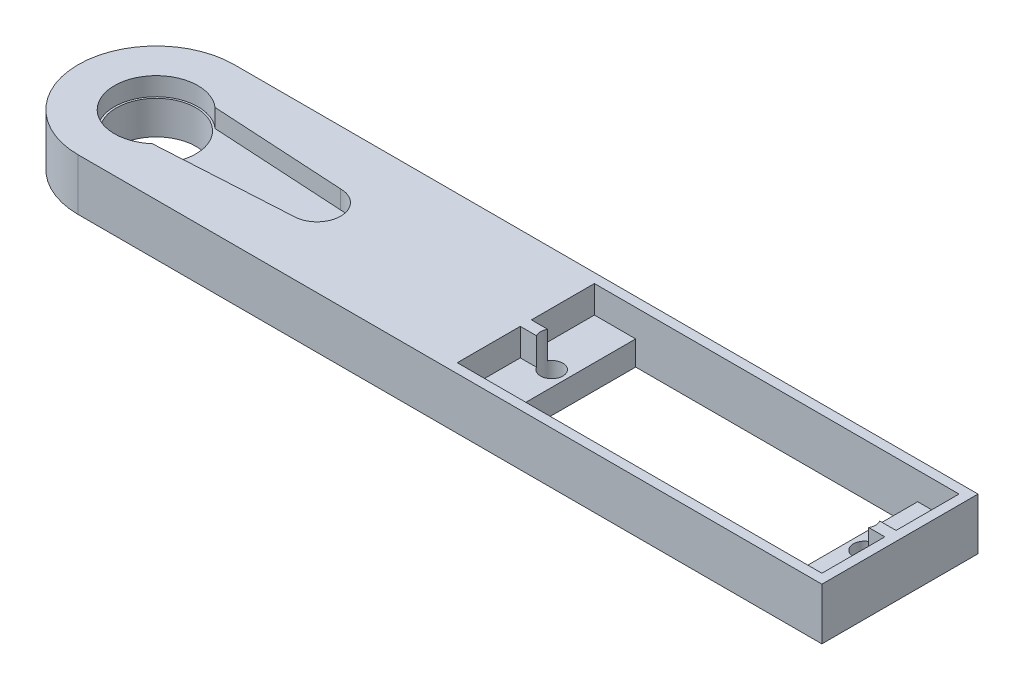
from build123d import *

# Parameters (mm, degrees)
BOSS_EXTRUDE1_DEPTH     = 3
SKETCH2_R               = 3.575
CUT_EXTRUDE1_DEPTH      = 3.95
BOSS_EXTRUDE2_DEPTH     = 1.64
SKETCH4_R               = 3.25
CUT_EXTRUDE2_DEPTH      = 63.566201739
CAVITY1_OUTLINE_R       = 3.25
CAVITY1_DEPTH           = 4.64
CAVITY1_START           = 3.19
CAVITY1_2_DEPTH         = 1.45
CUT_EXTRUDE4_DEPTH      = 63.566201739
BOSS_EXTRUDE3_START     = -4.64
BOSS_EXTRUDE3_DEPTH     = 4.64
BOSS_EXTRUDE4_DEPTH     = 4.64
BOSS_EXTRUDE5_DEPTH     = 4.64
CUT_EXTRUDE5_DEPTH      = 1.45
SKETCH7_R               = 1
CUT_EXTRUDE6_DEPTH      = 4.64
CUT_EXTRUDE7_DEPTH      = 68.226628653
CUT_EXTRUDE7_DEPTH_BACK = 68.226628653
SKETCH10_W              = 23.28963149
SKETCH10_H              = 12.3
SKETCH10_W_2            = 22.98963149
SKETCH10_H_2            = 12
CUT_EXTRUDE8_DEPTH      = 1.45
CUT_EXTRUDE9_DEPTH      = 1.45
SKETCH14_W              = 12.3
SKETCH14_H              = 3.19
CUT_EXTRUDE10_DEPTH     = 1
SKETCH15_W              = 12.3
SKETCH15_H              = 3.19
CUT_EXTRUDE11_DEPTH     = 1
CUT_EXTRUDE12_DEPTH     = 1
CUT_EXTRUDE13_DEPTH     = 1


# Read off the part's stored shape, not the designer's step: Cavity1
with BuildPart() as part:
    # Sketch1 → Boss-Extrude1 (new body)
    with BuildSketch(Plane(origin=(0, 0, 0), x_dir=(1, 0, 0), z_dir=(0, 1, 0))):
        with BuildLine():
            Line((0, 7), (55, 7))
            ThreePointArc((55, 7), (62, 0), (55, -7))
            Line((55, -7), (0, -7))
            ThreePointArc((0, -7), (-7, 0), (0, 7))
        make_face()
    extrude(amount=BOSS_EXTRUDE1_DEPTH)

    # Sketch2 → Cut-Extrude1 (cut)
    with BuildSketch(Plane.XZ):
        with Locations(Location((0, 0, 0), (0, 0, 270))):
            Circle(SKETCH2_R)
    extrude(amount=-CUT_EXTRUDE1_DEPTH, mode=Mode.SUBTRACT)

    # Sketch3 → Boss-Extrude2 (add)
    with BuildSketch(Plane(origin=(0, 3, 0), x_dir=(1, 0, 0), z_dir=(0, 1, 0))):
        with BuildLine():
            Line((0, -7), (55, -7))
            ThreePointArc((55, -7), (62, 0), (55, 7))
            Line((55, 7), (0, 7))
            ThreePointArc((0, 7), (-7, 0), (0, -7))
        make_face()
        with BuildLine():
            Line((14.43004688, 2.119993993), (2.468524523, 2.816276208))
            ThreePointArc((2.468524523, 2.816276208), (-3.745, 0), (2.468524523, -2.816276208))
            Line((2.468524523, -2.816276208), (14.43004688, -2.119993993))
            ThreePointArc((14.43004688, -2.119993993), (16.545, 0), (14.43004688, 2.119993993))
        make_face(mode=Mode.SUBTRACT)
    extrude(amount=BOSS_EXTRUDE2_DEPTH)

    # Sketch4 → Cut-Extrude2 (cut, through all)
    with BuildSketch(Plane(origin=(0, 4.64, 0), x_dir=(1, 0, 0), z_dir=(0, 1, 0))):
        with Locations(Location((55, 0, 0), (0, 0, 270))):
            Circle(SKETCH4_R)
    extrude(amount=-CUT_EXTRUDE2_DEPTH, mode=Mode.SUBTRACT)

    # Cavity1 outline → Cavity1 (cut)
    with BuildSketch(Plane(origin=(0, 0, 0), x_dir=(1, 0, 0), z_dir=(0, 1, 0))):
        with BuildLine():
            Line((58.605551275, 6), (38, 6))
            Line((38, 6), (38, -6))
            Line((38, -6), (58.605551275, -6))
            ThreePointArc((58.605551275, -6), (59.949747468, -4.949747468), (61, -3.605551275))
            Line((61, -3.605551275), (61, 3.605551275))
            ThreePointArc((61, 3.605551275), (59.949747468, 4.949747468), (58.605551275, 6))
        make_face()
        with Locations((55, 0)):
            Circle(CAVITY1_OUTLINE_R, mode=Mode.SUBTRACT)
    extrude(amount=CAVITY1_DEPTH, mode=Mode.SUBTRACT)

    # Cavity1 2 outline → Cavity1 2 (cut)
    with BuildSketch(Plane(origin=(0, 0, 0), x_dir=(1, 0, 0), z_dir=(0, 1, 0)).offset(CAVITY1_START)):
        with BuildLine():
            Line((33.3, 0.5), (34.605619966, 0.5))
            ThreePointArc((34.605619966, 0.5), (36.47164537, 0), (34.605619966, -0.5))
            Line((34.605619966, -0.5), (33.3, -0.5))
            Line((33.3, -0.5), (33.3, -6))
            Line((33.3, -6), (38, -6))
            Line((38, -6), (38, 6))
            Line((38, 6), (33.3, 6))
            Line((33.3, 6), (33.3, 0.5))
        make_face()
        with BuildLine():
            ThreePointArc((61, -3.605551275), (62, 0), (61, 3.605551275))
            Line((61, 3.605551275), (61, -3.605551275))
        make_face()
    extrude(amount=CAVITY1_2_DEPTH, mode=Mode.SUBTRACT)

    # Sketch5 → Cut-Extrude4 (cut, through all)
    with BuildSketch(Plane.XZ):
        with BuildLine():
            Line((61, 3.605551275), (61, -3.605551275))
            ThreePointArc((61, -3.605551275), (62, 0), (61, 3.605551275))
        make_face()
    extrude(amount=-CUT_EXTRUDE4_DEPTH, mode=Mode.SUBTRACT)

    # Sketch6 → Boss-Extrude3 (add)
    with BuildSketch(Plane(origin=(0, 4.64, 0), x_dir=(1, 0, 0), z_dir=(0, 1, 0)).offset(BOSS_EXTRUDE3_START)):
        with BuildLine():
            Line((61, -6), (58.605551275, -6))
            ThreePointArc((58.605551275, -6), (56.870828693, -6.745368782), (55, -7))
            Line((55, -7), (66.7, -7))
            Line((66.7, -7), (66.7, 7))
            Line((66.7, 7), (55, 7))
            ThreePointArc((55, 7), (56.870828693, 6.745368782), (58.605551275, 6))
            Line((58.605551275, 6), (61, 6))
            Line((61, 6), (65.7, 6))
            Line((65.7, 6), (65.7, 0.5))
            Line((65.7, 0.5), (65.7, -0.5))
            Line((65.7, -0.5), (65.7, -6))
            Line((65.7, -6), (61, -6))
        make_face()
        with BuildLine():
            Line((58.605551275, -6), (33.3, -6))
            Line((33.3, -6), (33.3, -7))
            Line((33.3, -7), (55, -7))
            ThreePointArc((55, -7), (56.870828693, -6.745368782), (58.605551275, -6))
        make_face()
        with BuildLine():
            Line((33.3, 7), (33.3, 6))
            Line((33.3, 6), (58.605551275, 6))
            ThreePointArc((58.605551275, 6), (56.870828693, 6.745368782), (55, 7))
            Line((55, 7), (33.3, 7))
        make_face()
    extrude(amount=BOSS_EXTRUDE3_DEPTH)

    # Sketch6<3> → Boss-Extrude4 (add)
    with BuildSketch(Plane(origin=(0, 4.64, 0), x_dir=(1, 0, 0), z_dir=(0, 1, 0))):
        with BuildLine():
            Line((64.394380034, -0.5), (65.7, -0.5))
            Line((65.7, -0.5), (65.7, 0.5))
            Line((65.7, 0.5), (64.394380034, 0.5))
            ThreePointArc((64.394380034, 0.5), (62.52835463, 0), (64.394380034, -0.5))
        make_face()
    extrude(amount=-BOSS_EXTRUDE4_DEPTH)

    # Sketch6<5> → Boss-Extrude5 (add)
    with BuildSketch(Plane(origin=(0, 4.64, 0), x_dir=(1, 0, 0), z_dir=(0, 1, 0))):
        with BuildLine():
            Line((61, 6), (61, -6))
            Line((61, -6), (65.7, -6))
            Line((65.7, -6), (65.7, -0.5))
            Line((65.7, -0.5), (64.394380034, -0.5))
            ThreePointArc((64.394380034, -0.5), (62.52835463, 0), (64.394380034, 0.5))
            Line((64.394380034, 0.5), (65.7, 0.5))
            Line((65.7, 0.5), (65.7, 6))
            Line((65.7, 6), (61, 6))
        make_face()
    extrude(amount=-BOSS_EXTRUDE5_DEPTH)

    # Sketch6<6> → Cut-Extrude5 (cut)
    with BuildSketch(Plane(origin=(0, 4.64, 0), x_dir=(1, 0, 0), z_dir=(0, 1, 0))):
        with BuildLine():
            Line((61, 6), (61, -6))
            Line((61, -6), (65.7, -6))
            Line((65.7, -6), (65.7, -0.5))
            Line((65.7, -0.5), (64.394380034, -0.5))
            ThreePointArc((64.394380034, -0.5), (62.52835463, 0), (64.394380034, 0.5))
            Line((64.394380034, 0.5), (65.7, 0.5))
            Line((65.7, 0.5), (65.7, 6))
            Line((65.7, 6), (61, 6))
        make_face()
    extrude(amount=-CUT_EXTRUDE5_DEPTH, mode=Mode.SUBTRACT)

    # Sketch7 → Cut-Extrude6 (cut)
    with BuildSketch(Plane(origin=(0, 4.64, 0), x_dir=(1, 0, 0), z_dir=(0, 1, 0))):
        with Locations(Location((63.52835463, 0, 0), (0, 0, 270))):
            Circle(SKETCH7_R)
        with Locations(Location((35.47164537, 0, 0), (0, 0, 270))):
            Circle(SKETCH7_R)
    extrude(amount=-CUT_EXTRUDE6_DEPTH, mode=Mode.SUBTRACT)

    # Sketch10 → Cut-Extrude7 (cut, two sides: drawn at the far end of the back side and taken through both)
    with BuildSketch(Plane.XZ.offset(-CUT_EXTRUDE7_DEPTH_BACK)):
        with Locations((49.494815745, 0)):
            Rectangle(SKETCH10_W, SKETCH10_H)
        with Locations((49.494815745, 0)):
            Rectangle(SKETCH10_W_2, SKETCH10_H_2, mode=Mode.SUBTRACT)
    extrude(amount=CUT_EXTRUDE7_DEPTH + CUT_EXTRUDE7_DEPTH_BACK, mode=Mode.SUBTRACT)

    # Sketch11 → Cut-Extrude8 (cut)
    with BuildSketch(Plane(origin=(0, 4.64, 0), x_dir=(1, 0, 0), z_dir=(0, 1, 0))):
        Polygon((37.85, -6), (33.3, -6), (33.3, -0.5), (33.15, -0.5), (33.15, -6.15), (37.85, -6.15), align=None)
        Polygon((33.3, 0.5), (33.3, 6), (37.85, 6), (37.85, 6.15), (33.15, 6.15), (33.15, 0.5), align=None)
    extrude(amount=-CUT_EXTRUDE8_DEPTH, mode=Mode.SUBTRACT)

    # Sketch13 → Cut-Extrude9 (cut)
    with BuildSketch(Plane(origin=(0, 4.64, 0), x_dir=(1, 0, 0), z_dir=(0, 1, 0))):
        Polygon((61.13963149, -6), (65.7, -6), (65.7, -0.5), (65.85, -0.5), (65.85, -6.15), (61.13963149, -6.15), align=None)
        Polygon((61.13963149, 6), (65.7, 6), (65.7, 0.5), (65.85, 0.5), (65.85, 6.15), (61.13963149, 6.15), align=None)
    extrude(amount=-CUT_EXTRUDE9_DEPTH, mode=Mode.SUBTRACT)

    # Sketch14 → Cut-Extrude10 (cut)
    with BuildSketch(Plane(origin=(37.85, 0, 0), x_dir=(0, 0, -1), z_dir=(1, 0, 0))):
        with Locations((0, 1.595)):
            Rectangle(SKETCH14_W, SKETCH14_H)
    extrude(amount=-CUT_EXTRUDE10_DEPTH, mode=Mode.SUBTRACT)

    # Sketch15 → Cut-Extrude11 (cut)
    with BuildSketch(Plane.ZY.offset(-61.13963149)):
        with Locations((0, 1.595)):
            Rectangle(SKETCH15_W, SKETCH15_H)
    extrude(amount=-CUT_EXTRUDE11_DEPTH, mode=Mode.SUBTRACT)

    # Sketch16 → Cut-Extrude12 (cut)
    with BuildSketch(Plane(origin=(0, 3.19, 0), x_dir=(1, 0, 0), z_dir=(0, 1, 0))):
        with BuildLine():
            Line((62.13963149, 6.15), (62.13963149, -6.15))
            Line((62.13963149, -6.15), (65.85, -6.15))
            Line((65.85, -6.15), (65.85, -0.5))
            Line((65.85, -0.5), (64.394380034, -0.5))
            ThreePointArc((64.394380034, -0.5), (62.52835463, 0), (64.394380034, 0.5))
            Line((64.394380034, 0.5), (65.85, 0.5))
            Line((65.85, 0.5), (65.85, 6.15))
            Line((65.85, 6.15), (62.13963149, 6.15))
        make_face()
    extrude(amount=-CUT_EXTRUDE12_DEPTH, mode=Mode.SUBTRACT)

    # Sketch17 → Cut-Extrude13 (cut)
    with BuildSketch(Plane(origin=(0, 3.19, 0), x_dir=(1, 0, 0), z_dir=(0, 1, 0))):
        with BuildLine():
            Line((36.85, -6.15), (36.85, 6.15))
            Line((36.85, 6.15), (33.15, 6.15))
            Line((33.15, 6.15), (33.15, 0.5))
            Line((33.15, 0.5), (34.605619966, 0.5))
            ThreePointArc((34.605619966, 0.5), (36.47164537, 0), (34.605619966, -0.5))
            Line((34.605619966, -0.5), (33.15, -0.5))
            Line((33.15, -0.5), (33.15, -6.15))
            Line((33.15, -6.15), (36.85, -6.15))
        make_face()
    extrude(amount=-CUT_EXTRUDE13_DEPTH, mode=Mode.SUBTRACT)


solid = part.part
